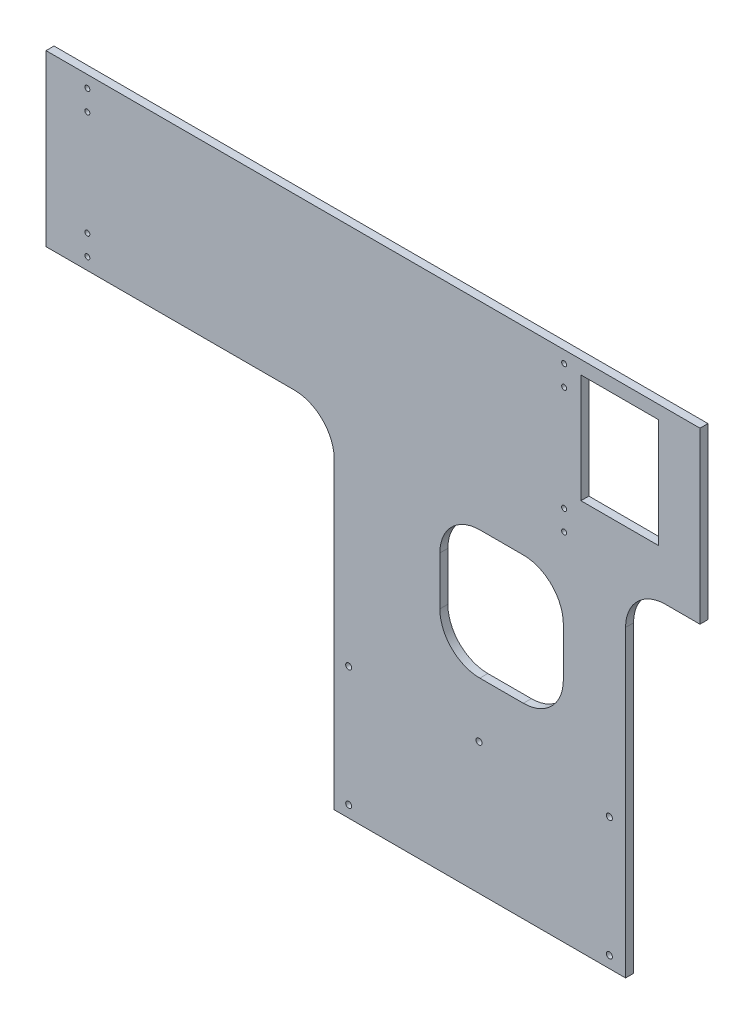
from build123d import *

# Parameters (mm, degrees)
CROQUIS1_R              = 2.5
CROQUIS1_W              = 77.478408342
CROQUIS1_H              = 109.077461589
CROQUIS1_W_2            = 123.605310211
CROQUIS1_H_2            = 128.516462854
SALIENTE_EXTRUIR1_DEPTH = 8
REDONDEO1_R             = 40
CROQUIS2_W              = 8
CROQUIS2_H              = 170
SALIENTE_EXTRUIR2_DEPTH = 5
CROQUIS3_W              = 8
CROQUIS3_H              = 170
SALIENTE_EXTRUIR3_DEPTH = 30
CROQUIS4_W              = 8
CROQUIS4_H              = 170
SALIENTE_EXTRUIR4_DEPTH = 30
CROQUIS5_R              = 3
CORTAR_EXTRUIR1_DEPTH   = 30


with BuildPart() as part:
    # Croquis1 → Saliente-Extruir1 (new body)
    with BuildSketch(Plane(origin=(0, 0, -35.287768798), x_dir=(-1, 0, 0), z_dir=(0, 0, -1))):
        Polygon((537.787991057, -113.999224426), (537.787991057, 56.000775574), (-51.831359741, 56.000775574), (-51.831359741, -113.999224426), (-7.340270166, -113.999224426), (-7.340270166, -457.935763063), (284.299805756, -457.935763063), (284.299805756, -113.999224426), align=None)
        with Locations((531.437991057, -101.999224426)):
            Circle(CROQUIS1_R, mode=Mode.SUBTRACT)
        with Locations((531.437991057, -81.499224426)):
            Circle(CROQUIS1_R, mode=Mode.SUBTRACT)
        with Locations((531.437991057, 23.500775574)):
            Circle(CROQUIS1_R, mode=Mode.SUBTRACT)
        with Locations((531.437991057, 44.000775574)):
            Circle(CROQUIS1_R, mode=Mode.SUBTRACT)
        with Locations((54.137991057, 44.000775574)):
            Circle(CROQUIS1_R, mode=Mode.SUBTRACT)
        with Locations((54.137991057, -101.999224426)):
            Circle(CROQUIS1_R, mode=Mode.SUBTRACT)
        with Locations((54.137991057, -81.499224426)):
            Circle(CROQUIS1_R, mode=Mode.SUBTRACT)
        with Locations((-1.387076296, -11.960493631)):
            Rectangle(CROQUIS1_W, CROQUIS1_H, mode=Mode.SUBTRACT)
        with Locations((54.137991057, 23.500775574)):
            Circle(CROQUIS1_R, mode=Mode.SUBTRACT)
        with Locations((116.749910344, -206.634344557)):
            Rectangle(CROQUIS1_W_2, CROQUIS1_H_2, mode=Mode.SUBTRACT)
    extrude(amount=SALIENTE_EXTRUIR1_DEPTH)

    # Redondeo1
    redondeo1_edges = [part.edges().sort_by_distance(p)[0] for p in [
        (-54.947255239, -270.892575984, -39.287768798),
        (-178.55256545, -270.892575984, -39.287768798),
        (-178.55256545, -142.37611313, -39.287768798),
        (-54.947255239, -142.37611313, -39.287768798),
        (7.340270166, -113.999224426, -39.287768798),
        (-284.299805756, -113.999224426, -39.287768798),
    ]]
    fillet(redondeo1_edges, radius=REDONDEO1_R)

    # Croquis2 → Saliente-Extruir2 (add)
    with BuildSketch(Plane.ZY.offset(537.787991057)):
        with Locations((-39.287768798, -28.999224426)):
            Rectangle(CROQUIS2_W, CROQUIS2_H)
    extrude(amount=SALIENTE_EXTRUIR2_DEPTH)

    # Croquis3 → Saliente-Extruir3 (add)
    with BuildSketch(Plane.ZY.offset(542.787991057)):
        with Locations((-39.287768798, -28.999224426)):
            Rectangle(CROQUIS3_W, CROQUIS3_H)
    extrude(amount=SALIENTE_EXTRUIR3_DEPTH)

    # Croquis4 → Saliente-Extruir4 (add)
    with BuildSketch(Plane(origin=(51.831359741, 0, 0), x_dir=(0, 0, -1), z_dir=(1, 0, 0))):
        with Locations((39.287768798, -28.999224426)):
            Rectangle(CROQUIS4_W, CROQUIS4_H)
    extrude(amount=SALIENTE_EXTRUIR4_DEPTH)

    # Croquis5 → Cortar-Extruir1 (cut)
    with BuildSketch(Plane(origin=(0, 0, -43.287768798), x_dir=(-1, 0, 0), z_dir=(0, 0, -1))):
        with Locations((8.841068429, -446.316406302)):
            Circle(CROQUIS5_R)
        with Locations((8.841068429, -326.316406302)):
            Circle(CROQUIS5_R)
        with Locations((139.33299328, -326.316406302)):
            Circle(CROQUIS5_R)
        with Locations((269.824918132, -326.316406302)):
            Circle(CROQUIS5_R)
        with Locations((269.824918132, -446.316406302)):
            Circle(CROQUIS5_R)
    extrude(amount=-CORTAR_EXTRUIR1_DEPTH, mode=Mode.SUBTRACT)


solid = part.part
